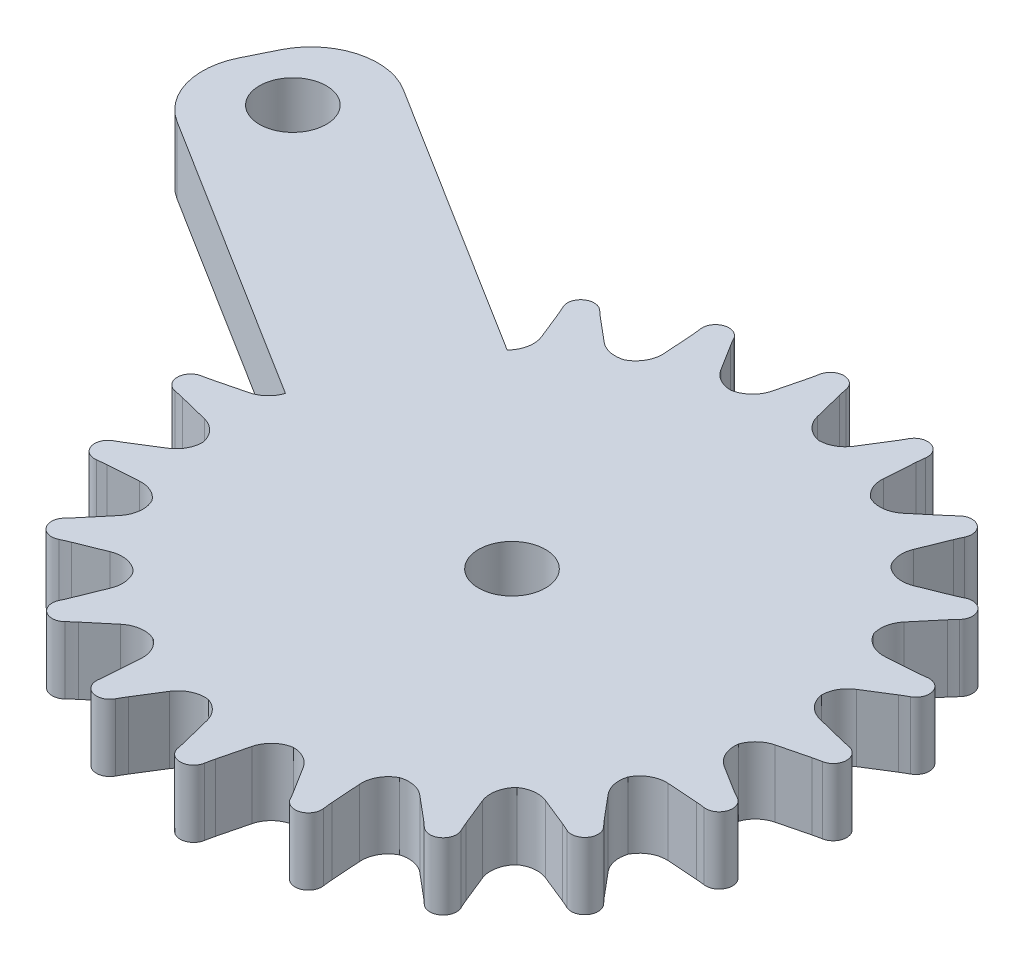
from build123d import *

# Parameters (mm, degrees)
SKETCH1_R           = 20
BOSS_EXTRUDE1_DEPTH = 5
BOSS_EXTRUDE2_START = -5
BOSS_EXTRUDE2_DEPTH = 5
FILLET1_R           = 2
CIRPATTERN1_DEPTH   = 5
SKETCH4_R           = 2.5
BOSS_EXTRUDE3_DEPTH = 5
FILLET2_R           = 5
SKETCH5_R           = 2.5
CUT_EXTRUDE1_DEPTH  = 10
SKETCH6_R           = 5
SKETCH6_R_2         = 2.5
BOSS_EXTRUDE4_DEPTH = 5
FILLET3_R           = 2


# Read off the part's stored shape, not the designer's step: CirPattern1
with BuildPart() as part:
    # Sketch1 → Boss-Extrude1 (new body)
    with BuildSketch(Plane(origin=(0, 0, 0), x_dir=(1, 0, 0), z_dir=(0, 1, 0))):
        with Locations(Location((0, 0, 0), (0, 0, 270))):
            Circle(SKETCH1_R)
    extrude(amount=BOSS_EXTRUDE1_DEPTH)

    # Sketch2 → Boss-Extrude2 (add)
    with BuildSketch(Plane(origin=(0, 5, 0), x_dir=(1, 0, 0), z_dir=(0, 1, 0)).offset(BOSS_EXTRUDE2_START)):
        with BuildLine():
            Line((-2.105791814, 19.888832063), (-1.238592318, 23.357630049))
            ThreePointArc((-1.238592318, 23.357630049), (-1.158488111, 23.704119695), (-1.090754777, 24.053238521))
            ThreePointArc((-1.090754777, 24.053238521), (-0.109023339, 24.880258639), (0.877972386, 24.059528275))
            ThreePointArc((0.877972386, 24.059528275), (0.941143779, 23.742067411), (1.014556469, 23.426817347))
            Line((1.014556469, 23.426817347), (1.893724984, 19.910143286))
            ThreePointArc((1.893724984, 19.910143286), (-0.106567477, 19.999716082), (-2.105791814, 19.888832063))
        make_face()
    extrude(amount=BOSS_EXTRUDE2_DEPTH)

    # Fillet1
    fillet1_edges = [part.edges().sort_by_distance(p)[0] for p in [
        (1.893724984, 2.5, -19.910143286),
        (-2.105791814, 2.5, -19.888832063),
    ]]
    fillet(fillet1_edges, radius=FILLET1_R)

    # CirPattern1 outline → CirPattern1 (add)
    with BuildSketch(Plane(origin=(0, 0, 0), x_dir=(1, 0, 0), z_dir=(0, 1, 0))):
        with BuildLine():
            ThreePointArc((-18.818349161, -15.020578024), (-18.496093443, -14.870168545), (-18.16869336, -14.731312705))
            Line((-18.16869336, -14.731312705), (-16.10451314, -13.898848252))
            ThreePointArc((-16.10451314, -13.898848252), (-14.969635701, -13.791456908), (-13.960430105, -14.321535926))
            ThreePointArc((-13.960430105, -14.321535926), (-16.121714854, -11.835975249), (-17.845731798, -9.029388491))
            ThreePointArc((-17.845731798, -9.029388491), (-17.643410931, -10.160914391), (-18.097403186, -11.216933153))
            Line((-18.097403186, -11.216933153), (-19.549034688, -12.94914432))
            ThreePointArc((-19.549034688, -12.94914432), (-19.760926451, -13.193835771), (-19.980626471, -13.431541317))
            ThreePointArc((-19.980626471, -13.431541317), (-20.064469753, -14.712450836), (-18.818349161, -15.020578024))
        make_face()
        with BuildLine():
            ThreePointArc((-8.242021953, 19.611282475), (-8.490583131, 18.498764143), (-9.306579914, 17.702756009))
            ThreePointArc((-9.306579914, 17.702756009), (-6.422679306, 18.940675556), (-3.380631018, 19.712212811))
            ThreePointArc((-3.380631018, 19.712212811), (-4.340011374, 19.966775936), (-5.058856916, 20.651227642))
            Line((-5.058856916, 20.651227642), (-6.274384144, 22.593742485))
            ThreePointArc((-6.274384144, 22.593742485), (-6.441621387, 22.870877344), (-6.599801755, 23.153279533))
            ThreePointArc((-6.599801755, 23.153279533), (-7.792110102, 23.628842042), (-8.470228911, 22.53892747))
            ThreePointArc((-8.470228911, 22.53892747), (-8.42676349, 22.185964985), (-8.395875928, 21.831680188))
            Line((-8.395875928, 21.831680188), (-8.242021953, 19.611282475))
        make_face()
        with BuildLine():
            ThreePointArc((-13.898848252, 16.10451314), (-13.791456908, 14.969635701), (-14.321535926, 13.960430105))
            ThreePointArc((-14.321535926, 13.960430105), (-11.961321637, 16.028935855), (-9.306579913, 17.702756008))
            ThreePointArc((-9.306579913, 17.702756008), (-10.297669185, 17.648395093), (-11.192839131, 18.077211859))
            Line((-11.192839131, 18.077211859), (-12.94914432, 19.549034688))
            ThreePointArc((-12.94914432, 19.549034688), (-13.193835771, 19.760926451), (-13.431541317, 19.980626471))
            ThreePointArc((-13.431541317, 19.980626471), (-14.712450836, 20.064469753), (-15.020578024, 18.818349161))
            ThreePointArc((-15.020578024, 18.818349161), (-14.870168545, 18.496093443), (-14.731312705, 18.16869336))
            Line((-14.731312705, 18.16869336), (-13.898848252, 16.10451314))
        make_face()
        with BuildLine():
            ThreePointArc((-18.195158445, 11.021321851), (-17.742326793, 9.975175019), (-17.934600217, 8.851560036))
            ThreePointArc((-17.934600217, 8.851560036), (-16.329106467, 11.548172233), (-14.321535925, 13.960430104))
            ThreePointArc((-14.321535925, 13.960430104), (-15.247319388, 13.602466375), (-16.231188267, 13.733672628))
            Line((-16.231188267, 13.733672628), (-18.356352028, 14.59073117))
            ThreePointArc((-18.356352028, 14.59073117), (-18.654545583, 14.716638395), (-18.948508031, 14.852130478))
            ThreePointArc((-18.948508031, 14.852130478), (-20.192634375, 14.536047367), (-20.100608305, 13.255699721))
            ThreePointArc((-20.100608305, 13.255699721), (-19.857977897, 12.995695406), (-19.624745956, 12.727228237))
            Line((-19.624745956, 12.727228237), (-18.195158445, 11.021321851))
        make_face()
        with BuildLine():
            ThreePointArc((-20.710399757, 4.85928679), (-19.956454114, 4.004274704), (-19.792100881, 2.876237597))
            ThreePointArc((-19.792100881, 2.876237597), (-19.098484585, 5.936993052), (-17.934600215, 8.851560035))
            ThreePointArc((-17.934600215, 8.851560035), (-18.704455735, 8.225033474), (-19.680715605, 8.045785833))
            Line((-19.680715605, 8.045785833), (-21.966712103, 8.204185225))
            ThreePointArc((-21.966712103, 8.204185225), (-22.289218499, 8.231783236), (-22.610662757, 8.269804472))
            ThreePointArc((-22.610662757, 8.269804472), (-23.696222171, 7.584735387), (-23.213050996, 6.395490034))
            ThreePointArc((-23.213050996, 6.395490034), (-22.901950013, 6.223188155), (-22.597172338, 6.039933339))
            Line((-22.597172338, 6.039933339), (-20.710399757, 4.85928679))
        make_face()
        with BuildLine():
            ThreePointArc((-21.198362842, -1.778409119), (-20.217104661, -2.358591919), (-19.712212811, -3.380631018))
            ThreePointArc((-19.712212811, -3.380631018), (-19.998369964, -0.255340374), (-19.792100879, 2.876237597))
            ThreePointArc((-19.792100879, 2.876237597), (-20.330669633, 2.042476989), (-21.203757377, 1.570321461))
            Line((-21.203757377, 1.570321461), (-23.426817347, 1.014556469))
            ThreePointArc((-23.426817347, 1.014556469), (-23.74206741, 0.941143779), (-24.059528275, 0.877972386))
            ThreePointArc((-24.059528275, 0.877972386), (-24.880258639, -0.109023339), (-24.053238521, -1.090754777))
            ThreePointArc((-24.053238521, -1.090754777), (-23.704119695, -1.158488111), (-23.357630049, -1.238592318))
            Line((-23.357630049, -1.238592318), (-21.198362842, -1.778409119))
        make_face()
        with BuildLine():
            ThreePointArc((-19.579720151, -8.239834962), (-18.612665626, -8.414862877), (-17.845731799, -9.029388492))
            ThreePointArc((-17.845731799, -9.029388492), (-18.990179463, -6.274797518), (-19.71221281, -3.380631018))
            ThreePointArc((-19.71221281, -3.380631018), (-19.966775936, -4.340011374), (-20.651227642, -5.058856916))
            Line((-20.651227642, -5.058856916), (-22.593742485, -6.274384144))
            ThreePointArc((-22.593742485, -6.274384144), (-22.870877344, -6.441621387), (-23.153279533, -6.599801755))
            ThreePointArc((-23.153279533, -6.599801755), (-23.628842042, -7.792110102), (-22.53892747, -8.470228911))
            ThreePointArc((-22.53892747, -8.470228911), (-22.185964985, -8.42676349), (-21.831680188, -8.395875928))
            Line((-21.831680188, -8.395875928), (-19.579720151, -8.239834962))
        make_face()
        with BuildLine():
            ThreePointArc((3.184529229, 19.744841696), (6.085729599, 19.051611356), (8.851560036, 17.934600217))
            ThreePointArc((8.851560036, 17.934600217), (8.225033474, 18.704455735), (8.045785833, 19.680715605))
            Line((8.045785833, 19.680715605), (8.204185225, 21.966712103))
            ThreePointArc((8.204185225, 21.966712103), (8.231783236, 22.289218499), (8.269804472, 22.610662757))
            ThreePointArc((8.269804472, 22.610662757), (7.584735387, 23.696222171), (6.395490034, 23.213050996))
            ThreePointArc((6.395490034, 23.213050996), (6.223188155, 22.901950013), (6.039933339, 22.597172338))
            Line((6.039933339, 22.597172338), (4.842504233, 20.683579819))
            ThreePointArc((4.842504233, 20.683579819), (4.132483288, 20.004095101), (3.184529229, 19.744841696))
        make_face()
        with BuildLine():
            ThreePointArc((8.851560036, 17.934600217), (11.548172234, 16.329106469), (13.960430106, 14.321535927))
            ThreePointArc((13.960430106, 14.321535927), (13.602466375, 15.247319388), (13.733672628, 16.231188267))
            Line((13.733672628, 16.231188267), (14.59073117, 18.356352028))
            ThreePointArc((14.59073117, 18.356352028), (14.716638395, 18.654545583), (14.852130478, 18.948508031))
            ThreePointArc((14.852130478, 18.948508031), (14.536047367, 20.192634375), (13.255699721, 20.100608305))
            ThreePointArc((13.255699721, 20.100608305), (12.995695406, 19.857977897), (12.727228237, 19.624745956))
            Line((12.727228237, 19.624745956), (11.021321851, 18.195158445))
            ThreePointArc((11.021321851, 18.195158445), (9.975175019, 17.742326793), (8.851560036, 17.934600217))
        make_face()
        with BuildLine():
            ThreePointArc((13.960430106, 14.321535927), (16.028935857, 11.961321639), (17.70275601, 9.306579915))
            ThreePointArc((17.70275601, 9.306579915), (17.648395093, 10.297669185), (18.077211859, 11.192839131))
            Line((18.077211859, 11.192839131), (19.549034688, 12.94914432))
            ThreePointArc((19.549034688, 12.94914432), (19.760926451, 13.193835771), (19.980626471, 13.431541317))
            ThreePointArc((19.980626471, 13.431541317), (20.064469753, 14.712450836), (18.818349161, 15.020578024))
            ThreePointArc((18.818349161, 15.020578024), (18.496093443, 14.870168545), (18.16869336, 14.731312705))
            Line((18.16869336, 14.731312705), (16.10451314, 13.898848252))
            ThreePointArc((16.10451314, 13.898848252), (14.969635701, 13.791456908), (13.960430106, 14.321535927))
        make_face()
        with BuildLine():
            ThreePointArc((17.70275601, 9.306579915), (18.940675558, 6.422679307), (19.712212813, 3.380631018))
            ThreePointArc((19.712212813, 3.380631018), (19.966775936, 4.340011374), (20.651227642, 5.058856916))
            Line((20.651227642, 5.058856916), (22.593742485, 6.274384144))
            ThreePointArc((22.593742485, 6.274384144), (22.870877344, 6.441621387), (23.153279533, 6.599801755))
            ThreePointArc((23.153279533, 6.599801755), (23.628842042, 7.792110102), (22.53892747, 8.470228911))
            ThreePointArc((22.53892747, 8.470228911), (22.185964985, 8.42676349), (21.831680188, 8.395875928))
            Line((21.831680188, 8.395875928), (19.611282475, 8.242021953))
            ThreePointArc((19.611282475, 8.242021953), (18.498764143, 8.490583131), (17.70275601, 9.306579915))
        make_face()
        with BuildLine():
            ThreePointArc((19.712212813, 3.380631018), (19.998369968, 0.255340374), (19.792100883, -2.876237597))
            ThreePointArc((19.792100883, -2.876237597), (20.330669633, -2.042476989), (21.203757377, -1.570321461))
            Line((21.203757377, -1.570321461), (23.426817347, -1.014556469))
            ThreePointArc((23.426817347, -1.014556469), (23.74206741, -0.941143779), (24.059528275, -0.877972386))
            ThreePointArc((24.059528275, -0.877972386), (24.880258639, 0.109023339), (24.053238521, 1.090754777))
            ThreePointArc((24.053238521, 1.090754777), (23.704119695, 1.158488111), (23.357630049, 1.238592318))
            Line((23.357630049, 1.238592318), (21.198362842, 1.778409119))
            ThreePointArc((21.198362842, 1.778409119), (20.217104661, 2.358591919), (19.712212813, 3.380631018))
        make_face()
        with BuildLine():
            ThreePointArc((19.792100883, -2.876237597), (19.051611357, -6.085729599), (17.794386708, -9.130158911))
            ThreePointArc((17.794386708, -9.130158911), (18.590889166, -8.301383653), (19.712076244, -8.047958848))
            Line((19.712076244, -8.047958848), (21.966712103, -8.204185225))
            ThreePointArc((21.966712103, -8.204185225), (22.289218499, -8.231783236), (22.610662757, -8.269804472))
            ThreePointArc((22.610662757, -8.269804472), (23.696222171, -7.584735387), (23.213050996, -6.395490034))
            ThreePointArc((23.213050996, -6.395490034), (22.901950013, -6.223188155), (22.597172338, -6.039933339))
            Line((22.597172338, -6.039933339), (20.710399757, -4.85928679))
            ThreePointArc((20.710399757, -4.85928679), (19.956454114, -4.004274704), (19.792100883, -2.876237597))
        make_face()
        with BuildLine():
            ThreePointArc((17.794386708, -9.130158911), (16.238565258, -11.675144471), (14.321535927, -13.960430106))
            ThreePointArc((14.321535927, -13.960430106), (15.247319388, -13.602466375), (16.231188267, -13.733672628))
            Line((16.231188267, -13.733672628), (18.356352028, -14.59073117))
            ThreePointArc((18.356352028, -14.59073117), (18.654545583, -14.716638395), (18.948508031, -14.852130478))
            ThreePointArc((18.948508031, -14.852130478), (20.192634375, -14.536047367), (20.100608305, -13.255699721))
            ThreePointArc((20.100608305, -13.255699721), (19.857977897, -12.995695406), (19.624745956, -12.727228237))
            Line((19.624745956, -12.727228237), (18.174837264, -10.997072875))
            ThreePointArc((18.174837264, -10.997072875), (17.748017433, -10.111830503), (17.794386708, -9.130158911))
        make_face()
        with BuildLine():
            ThreePointArc((14.321535927, -13.960430106), (11.961321639, -16.028935857), (9.306579914, -17.70275601))
            ThreePointArc((9.306579914, -17.70275601), (10.297669185, -17.648395093), (11.192839131, -18.077211859))
            Line((11.192839131, -18.077211859), (12.94914432, -19.549034688))
            ThreePointArc((12.94914432, -19.549034688), (13.193835771, -19.760926451), (13.431541317, -19.980626471))
            ThreePointArc((13.431541317, -19.980626471), (14.712450836, -20.064469753), (15.020578024, -18.818349161))
            ThreePointArc((15.020578024, -18.818349161), (14.870168545, -18.496093443), (14.731312705, -18.16869336))
            Line((14.731312705, -18.16869336), (13.898848252, -16.10451314))
            ThreePointArc((13.898848252, -16.10451314), (13.791456908, -14.969635701), (14.321535927, -13.960430106))
        make_face()
        with BuildLine():
            ThreePointArc((9.306579914, -17.70275601), (6.422679306, -18.940675557), (3.380631018, -19.712212812))
            ThreePointArc((3.380631018, -19.712212812), (4.340011374, -19.966775936), (5.058856916, -20.651227642))
            Line((5.058856916, -20.651227642), (6.274384144, -22.593742485))
            ThreePointArc((6.274384144, -22.593742485), (6.441621387, -22.870877344), (6.599801755, -23.153279533))
            ThreePointArc((6.599801755, -23.153279533), (7.792110102, -23.628842042), (8.470228911, -22.53892747))
            ThreePointArc((8.470228911, -22.53892747), (8.42676349, -22.185964985), (8.395875928, -21.831680188))
            Line((8.395875928, -21.831680188), (8.242021953, -19.611282475))
            ThreePointArc((8.242021953, -19.611282475), (8.490583131, -18.498764143), (9.306579914, -17.70275601))
        make_face()
        with BuildLine():
            ThreePointArc((3.380631018, -19.712212812), (0.255340374, -19.998369966), (-2.876237597, -19.792100881))
            ThreePointArc((-2.876237597, -19.792100881), (-2.042476989, -20.330669633), (-1.570321461, -21.203757377))
            Line((-1.570321461, -21.203757377), (-1.014556469, -23.426817347))
            ThreePointArc((-1.014556469, -23.426817347), (-0.941143779, -23.74206741), (-0.877972386, -24.059528275))
            ThreePointArc((-0.877972386, -24.059528275), (0.109023339, -24.880258639), (1.090754777, -24.053238521))
            ThreePointArc((1.090754777, -24.053238521), (1.158488111, -23.704119695), (1.238592318, -23.357630049))
            Line((1.238592318, -23.357630049), (1.778409119, -21.198362842))
            ThreePointArc((1.778409119, -21.198362842), (2.358591919, -20.217104661), (3.380631018, -19.712212812))
        make_face()
        with BuildLine():
            ThreePointArc((-2.876237597, -19.792100881), (-5.936993053, -19.098484586), (-8.851560035, -17.934600216))
            ThreePointArc((-8.851560035, -17.934600216), (-8.225033474, -18.704455735), (-8.045785833, -19.680715605))
            Line((-8.045785833, -19.680715605), (-8.204185225, -21.966712103))
            ThreePointArc((-8.204185225, -21.966712103), (-8.231783236, -22.289218499), (-8.269804472, -22.610662757))
            ThreePointArc((-8.269804472, -22.610662757), (-7.584735387, -23.696222171), (-6.395490034, -23.213050996))
            ThreePointArc((-6.395490034, -23.213050996), (-6.223188155, -22.901950013), (-6.039933339, -22.597172338))
            Line((-6.039933339, -22.597172338), (-4.85928679, -20.710399757))
            ThreePointArc((-4.85928679, -20.710399757), (-4.004274704, -19.956454114), (-2.876237597, -19.792100881))
        make_face()
        with BuildLine():
            ThreePointArc((-8.851560035, -17.934600216), (-11.548172233, -16.329106468), (-13.960430104, -14.321535925))
            ThreePointArc((-13.960430104, -14.321535925), (-13.602466375, -15.247319388), (-13.733672628, -16.231188267))
            Line((-13.733672628, -16.231188267), (-14.59073117, -18.356352028))
            ThreePointArc((-14.59073117, -18.356352028), (-14.716638395, -18.654545583), (-14.852130478, -18.948508031))
            ThreePointArc((-14.852130478, -18.948508031), (-14.536047367, -20.192634375), (-13.255699721, -20.100608305))
            ThreePointArc((-13.255699721, -20.100608305), (-12.995695406, -19.857977897), (-12.727228237, -19.624745956))
            Line((-12.727228237, -19.624745956), (-11.021321851, -18.195158445))
            ThreePointArc((-11.021321851, -18.195158445), (-9.975175019, -17.742326793), (-8.851560035, -17.934600216))
        make_face()
    extrude(amount=CIRPATTERN1_DEPTH)

    # Sketch4 → Boss-Extrude3 (add)
    with BuildSketch(Plane.XZ):
        Polygon((-19.792100881, -2.876237597), (-45.22348238, -18.789905781), (-39.752917424, -29.87409829), (-14.321535926, -13.960430105), align=None)
        with Locations(Location((-38.161766516, -21.800567263, 0), (0, 0, 270))):
            Circle(SKETCH4_R, mode=Mode.SUBTRACT)
    extrude(amount=-BOSS_EXTRUDE3_DEPTH)

    # Fillet2
    fillet2_edges = [part.edges().sort_by_distance(p)[0] for p in [
        (-39.752917424, 2.5, -29.87409829),
        (-45.22348238, 2.5, -18.789905781),
    ]]
    fillet(fillet2_edges, radius=FILLET2_R)

    # Sketch5 → Cut-Extrude1 (cut)
    with BuildSketch(Plane(origin=(0, 5, 0), x_dir=(1, 0, 0), z_dir=(0, 1, 0))):
        with Locations(Location((0, 0, 0), (0, 0, 270))):
            Circle(SKETCH5_R)
    extrude(amount=-CUT_EXTRUDE1_DEPTH, mode=Mode.SUBTRACT)

    # Sketch6 → Boss-Extrude4 (add)
    with BuildSketch(Plane.XZ):
        with Locations(Location((0, 0, 0), (0, 0, 90))):
            Circle(SKETCH6_R)
        with Locations(Location((0, 0, 0), (0, 0, 90))):
            Circle(SKETCH6_R_2, mode=Mode.SUBTRACT)
    extrude(amount=BOSS_EXTRUDE4_DEPTH)

    # Fillet3
    fillet3_edges = [part.edges().sort_by_distance(p)[0] for p in [
        (0, 0, -5),
    ]]
    fillet(fillet3_edges, radius=FILLET3_R)


solid = part.part
